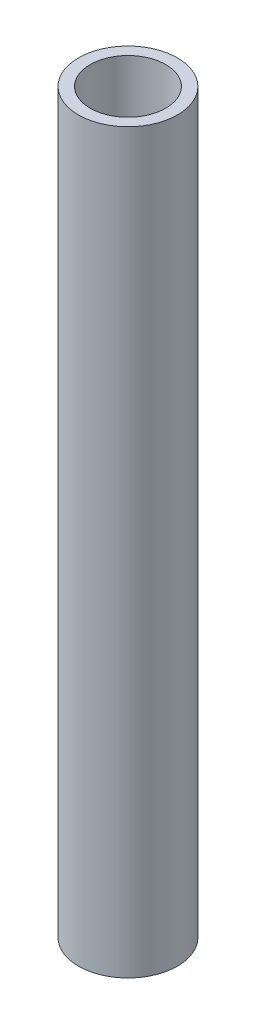
from build123d import *

# Parameters (mm, degrees)
SKETCH1_R    = 0.6477
SKETCH1_R_2  = 0.4953
NEEDLE_DEPTH = 9.652


with BuildPart() as part:
    # Sketch1 → Needle (new body)
    with BuildSketch(Plane(origin=(0, 0, 0), x_dir=(1, 0, 0), z_dir=(0, 1, 0))):
        Circle(SKETCH1_R)
        Circle(SKETCH1_R_2, mode=Mode.SUBTRACT)
    extrude(amount=-NEEDLE_DEPTH)


solid = part.part
